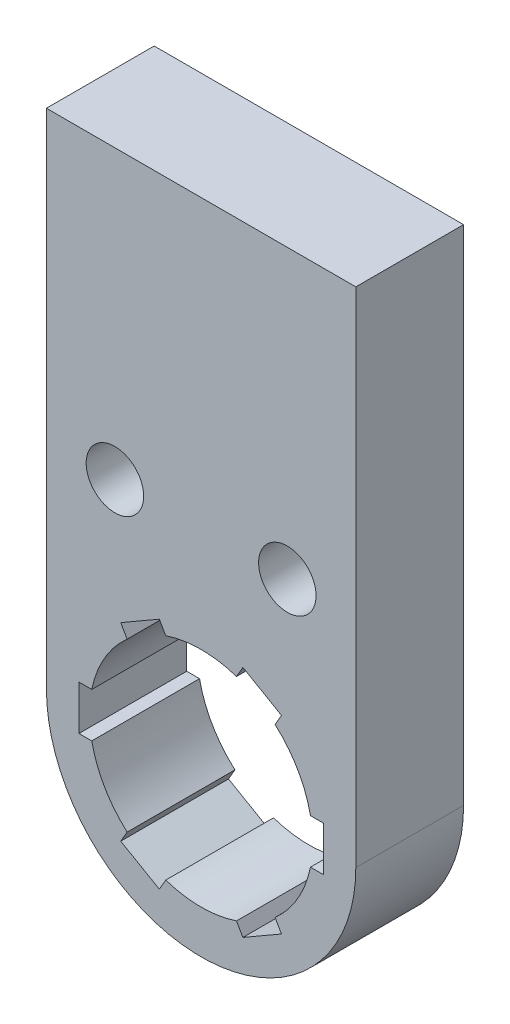
from build123d import *

# Parameters (mm, degrees)
SKETCH1_R           = 4.765
SKETCH1_R_2         = 2
BOSS_EXTRUDE1_DEPTH = 7.5
CUT_EXTRUDE1_REACH  = 33.162


with BuildPart() as part:
    # Sketch1 → Boss-Extrude1 (new body)
    with BuildSketch(Plane.XY):
        with BuildLine():
            Line((-10.765, 17.5), (10.765, 17.5))
            Line((10.765, 17.5), (10.765, -17.5))
            ThreePointArc((10.765, -17.5), (0, -28.265), (-10.765, -17.5))
            Line((-10.765, -17.5), (-10.765, 17.5))
        make_face()
        with Locations((0, -17.5)):
            Circle(SKETCH1_R, mode=Mode.SUBTRACT)
        with Locations((-6, -2.5)):
            Circle(SKETCH1_R_2, mode=Mode.SUBTRACT)
        with Locations((6, -2.5)):
            Circle(SKETCH1_R_2, mode=Mode.SUBTRACT)
    extrude(amount=BOSS_EXTRUDE1_DEPTH)

    # Sketch3 → Cut-Extrude1 (cut, up to next)
    with BuildSketch(Plane.XY.offset(7.5), mode=Mode.PRIVATE) as cut_extrude1_sk1:
        with BuildLine():
            Line((-2.907660624, -9.363784068), (-5.592339376, -10.913784068))
            Line((-5.592339376, -10.913784068), (-5.146702825, -11.685649216))
            ThreePointArc((-5.146702825, -11.685649216), (-6.72468726, -13.6175), (-7.608726897, -15.95))
            Line((-7.608726897, -15.95), (-8.5, -15.95))
            Line((-8.5, -15.95), (-8.5, -19.05))
            Line((-8.5, -19.05), (-7.608726897, -19.05))
            ThreePointArc((-7.608726897, -19.05), (-6.72468726, -21.3825), (-5.146702825, -23.314350784))
            Line((-5.146702825, -23.314350784), (-5.592339376, -24.086215932))
            Line((-5.592339376, -24.086215932), (-2.907660624, -25.636215932))
            Line((-2.907660624, -25.636215932), (-2.462024073, -24.864350784))
            ThreePointArc((-2.462024073, -24.864350784), (0, -25.265), (2.462024073, -24.864350784))
            Line((2.462024073, -24.864350784), (2.907660624, -25.636215932))
            Line((2.907660624, -25.636215932), (5.592339376, -24.086215932))
            Line((5.592339376, -24.086215932), (5.146702825, -23.314350784))
            ThreePointArc((5.146702825, -23.314350784), (6.72468726, -21.3825), (7.608726897, -19.05))
            Line((7.608726897, -19.05), (8.5, -19.05))
            Line((8.5, -19.05), (8.5, -15.95))
            Line((8.5, -15.95), (7.608726897, -15.95))
            ThreePointArc((7.608726897, -15.95), (6.72468726, -13.6175), (5.146702825, -11.685649216))
            Line((5.146702825, -11.685649216), (5.592339376, -10.913784068))
            Line((5.592339376, -10.913784068), (2.907660624, -9.363784068))
            Line((2.907660624, -9.363784068), (2.462024073, -10.135649216))
            ThreePointArc((2.462024073, -10.135649216), (0, -9.735), (-2.462024073, -10.135649216))
            Line((-2.462024073, -10.135649216), (-2.907660624, -9.363784068))
        make_face()
    cut_extrude1_tool1 = extrude(cut_extrude1_sk1.sketch, amount=-CUT_EXTRUDE1_REACH, mode=Mode.PRIVATE) & part.part
    add(cut_extrude1_tool1.solids().sort_by_distance((0, -17.5, 7.5))[0], mode=Mode.SUBTRACT)


solid = part.part
